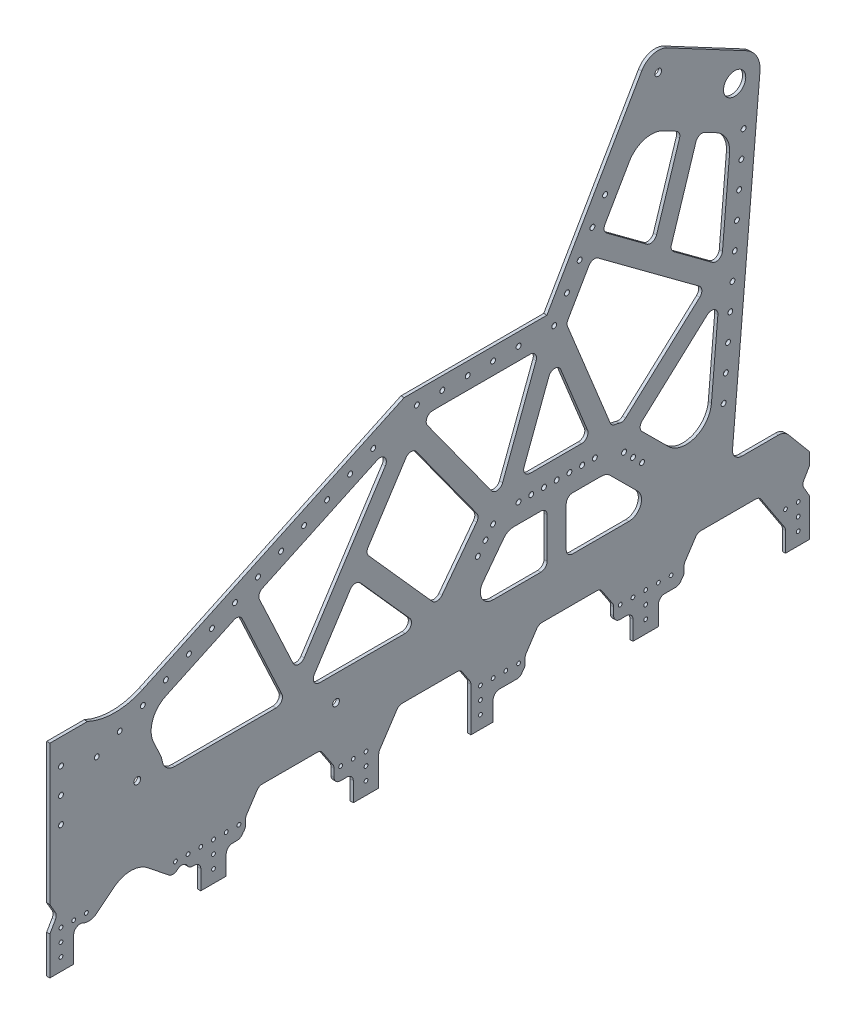
from build123d import *

# Parameters (mm, degrees)
BOSS_EXTRUDE1_DEPTH          = 3.175
F_1_4_CLEARANCE_HOLE1_D      = 6.7564
CUT_EXTRUDE4_START           = -3.175
CUT_EXTRUDE4_DEPTH           = 3.175
F_7_8_0_875_DIAMETER_HOLE1_D = 22.225
F_6_CLEARANCE_HOLE1_D        = 3.7973
F_8_CLEARANCE_HOLE1_D        = 4.9149
F_8_CLEARANCE_HOLE2_D        = 4.9149
CUT_EXTRUDE8_DEPTH           = 607.618253258


# Read off the part's stored shape, not the designer's step: Cut-Extrude4
with BuildPart() as part:
    # Sketch1 → Boss-Extrude1 (new body)
    with BuildSketch(Plane(origin=(0, 0, 0), x_dir=(0, 0, -1), z_dir=(1, 0, 0))):
        with BuildLine():
            Line((-379.4125, -25.4), (379.4125, -25.4))
            Line((379.4125, -25.4), (379.4125, 12.7))
            Line((379.4125, 12.7), (373.913238686, 22.225))
            ThreePointArc((373.913238686, 22.225), (373.0625, 25.4), (373.913238686, 28.575))
            Line((373.913238686, 28.575), (379.4125, 38.1))
            Line((379.4125, 38.1), (379.4125, 50.8))
            Line((379.4125, 50.8), (358.334081892, 75.920280507))
            ThreePointArc((358.334081892, 75.920280507), (353.972569388, 79.266986759), (348.605317464, 80.456877864))
            Line((348.605317464, 80.456877864), (312.169853675, 80.456877864))
            ThreePointArc((312.169853675, 80.456877864), (305.147287042, 83.546881136), (302.681099176, 90.812036313))
            Line((302.681099176, 90.812036313), (330.103345332, 404.249744134))
            ThreePointArc((330.103345332, 404.249744134), (327.121530688, 418.584113341), (316.72300865, 428.891203064))
            Line((316.72300865, 428.891203064), (237.363712035, 471.080168083))
            ThreePointArc((237.363712035, 471.080168083), (223.169923354, 472.571242401), (211.923671605, 463.784390785))
            Line((211.923671605, 463.784390785), (117.237713163, 299.7835))
            Line((117.237713163, 299.7835), (-25.4, 299.7835))
            Line((-25.4, 299.7835), (-286.994459938, 177.8))
            ThreePointArc((-286.994459938, 177.8), (-314.449155618, 171.713440503), (-341.903851297, 177.8))
            Line((-341.903851297, 177.8), (-379.4125, 177.8))
            Line((-379.4125, 177.8), (-379.4125, 38.1))
            Line((-379.4125, 38.1), (-373.913238686, 28.575))
            ThreePointArc((-373.913238686, 28.575), (-373.0625, 25.4), (-373.913238686, 22.225))
            Line((-373.913238686, 22.225), (-379.4125, 12.7))
            Line((-379.4125, 12.7), (-379.4125, -25.4))
        make_face()
    extrude(amount=BOSS_EXTRUDE1_DEPTH)

    # 1/4 Clearance Hole1 (through all)
    with Locations(Plane(origin=(0, 0, 0), x_dir=(0, 0, -1), z_dir=(-1, 0, 0))):
        with Locations((-292.1, -101.6635), (-93.476017085, -69.9135), (228.421455547, -454.259390785)):
            Hole(F_1_4_CLEARANCE_HOLE1_D / 2)

    # Cut-Extrude4 outline → Cut-Extrude4 (cut)
    with BuildSketch(Plane(origin=(3.175, 0, 0), x_dir=(0, 0, -1), z_dir=(1, 0, 0)).offset(CUT_EXTRUDE4_START)):
        with BuildLine():
            Line((228.6, -6.35), (228.6, -25.4))
            Line((228.6, -25.4), (355.6, -25.4))
            Line((355.6, -25.4), (355.6, -5.68485798))
            ThreePointArc((355.6, -5.68485798), (355.335085484, -3.869855319), (354.562445777, -2.206292203))
            Line((354.562445777, -2.206292203), (331.164598945, 33.526765777))
            ThreePointArc((331.164598945, 33.526765777), (328.871557688, 35.634405899), (325.852153167, 36.3982))
            Line((325.852153167, 36.3982), (271.047846833, 36.3982))
            ThreePointArc((271.047846833, 36.3982), (268.028442312, 35.634405899), (265.735401055, 33.526765777))
            Line((265.735401055, 33.526765777), (255.263259125, 17.533770462))
            ThreePointArc((255.263259125, 17.533770462), (254.490619419, 15.870207345), (254.225704902, 14.055204685))
            Line((254.225704902, 14.055204685), (254.225704902, 9.041792552))
            ThreePointArc((254.225704902, 9.041792552), (253.733950669, 6.591597349), (252.334852451, 4.520896276))
            ThreePointArc((252.334852451, 4.520896276), (251.7695263, 3.882932401), (251.294738686, 3.175))
            ThreePointArc((251.294738686, 3.175), (248.970477372, 0.850738686), (245.795477372, 0))
            Line((245.795477372, 0), (234.95, 0))
            ThreePointArc((234.95, 0), (230.459871939, -1.859871939), (228.6, -6.35))
        make_face()
        with BuildLine():
            Line((63.5, -6.35), (63.5, -25.4))
            Line((63.5, -25.4), (203.2, -25.4))
            Line((203.2, -25.4), (203.2, -6.35))
            ThreePointArc((203.2, -6.35), (201.340128061, -1.859871939), (196.85, 0))
            Line((196.85, 0), (190.274295098, 0))
            ThreePointArc((190.274295098, 0), (185.784167037, 1.859871939), (183.924295098, 6.35))
            Line((183.924295098, 6.35), (183.924295098, 14.06007184))
            ThreePointArc((183.924295098, 14.06007184), (183.65487103, 15.890125483), (182.869461606, 17.564884481))
            Line((182.869461606, 17.564884481), (172.287094914, 33.553012641))
            ThreePointArc((172.287094914, 33.553012641), (169.99750154, 35.641859816), (166.991928406, 36.3982))
            Line((166.991928406, 36.3982), (112.297846833, 36.3982))
            ThreePointArc((112.297846833, 36.3982), (109.278442312, 35.634405899), (106.985401055, 33.526765777))
            Line((106.985401055, 33.526765777), (96.513259125, 17.533770462))
            ThreePointArc((96.513259125, 17.533770462), (95.740619418, 15.870207346), (95.475704902, 14.055204685))
            Line((95.475704902, 14.055204685), (95.475704902, 9.041792552))
            ThreePointArc((95.475704902, 9.041792552), (94.983950669, 6.591597349), (93.584852451, 4.520896276))
            ThreePointArc((93.584852451, 4.520896276), (93.0195263, 3.882932401), (92.544738686, 3.175))
            ThreePointArc((92.544738686, 3.175), (90.220477372, 0.850738686), (87.045477372, 0))
            Line((87.045477372, 0), (69.85, 0))
            ThreePointArc((69.85, 0), (65.359871939, -1.859871939), (63.5, -6.35))
        make_face()
        with BuildLine():
            Line((-50.8, 3.885825734), (-50.8, -25.4))
            Line((-50.8, -25.4), (41.275, -25.4))
            Line((41.275, -25.4), (41.275, 18.388947296))
            ThreePointArc((41.275, 18.388947296), (41.005575932, 20.219000939), (40.220166508, 21.893759937))
            Line((40.220166508, 21.893759937), (32.587094914, 33.426012641))
            ThreePointArc((32.587094914, 33.426012641), (30.29750154, 35.514859816), (27.291928406, 36.2712))
            Line((27.291928406, 36.2712), (-27.402153167, 36.2712))
            ThreePointArc((-27.402153167, 36.2712), (-30.421557688, 35.507405899), (-32.714598945, 33.399765777))
            Line((-32.714598945, 33.399765777), (-49.762445777, 7.364391511))
            ThreePointArc((-49.762445777, 7.364391511), (-50.535085484, 5.700828395), (-50.8, 3.885825734))
        make_face()
        with BuildLine():
            Line((-355.6, -25.4), (-228.6, -25.4))
            Line((-228.6, -25.4), (-228.6, -6.35))
            ThreePointArc((-228.6, -6.35), (-230.459871939, -1.859871939), (-234.95, 0))
            Line((-234.95, 0), (-236.651477372, 0))
            ThreePointArc((-236.651477372, 0), (-239.826477372, 0.850738686), (-242.150738686, 3.175))
            ThreePointArc((-242.150738686, 3.175), (-246.773772418, 6.289254743), (-252.071994637, 4.557242964))
            ThreePointArc((-252.071994637, 4.557242964), (-256.191826183, 2.771679177), (-260.462739274, 4.157518766))
            Line((-260.462739274, 4.157518766), (-281.5828125, 21.067110435))
            ThreePointArc((-281.5828125, 21.067110435), (-298.45, 26.9875), (-315.3171875, 21.067110435))
            Line((-315.3171875, 21.067110435), (-332.754905569, 7.10576243))
            ThreePointArc((-332.754905569, 7.10576243), (-339.366140336, 4.389137758), (-346.397468523, 5.673232251))
            ThreePointArc((-346.397468523, 5.673232251), (-352.582335902, 5.405371166), (-355.6, 0))
            Line((-355.6, 0), (-355.6, -25.4))
        make_face()
        with BuildLine():
            Line((-76.2, -25.4), (-76.2, -6.35))
            ThreePointArc((-76.2, -6.35), (-78.059871939, -1.859871939), (-82.55, 0))
            Line((-82.55, 0), (-89.125704902, 0))
            ThreePointArc((-89.125704902, 0), (-93.615832963, 1.859871939), (-95.475704902, 6.35))
            Line((-95.475704902, 6.35), (-95.475704902, 14.106934369))
            ThreePointArc((-95.475704902, 14.106934369), (-95.74512897, 15.936988012), (-96.530538394, 17.61174701))
            Line((-96.530538394, 17.61174701), (-107.023045357, 33.464112641))
            ThreePointArc((-107.023045357, 33.464112641), (-109.312638731, 35.552959816), (-112.318211865, 36.3093))
            Line((-112.318211865, 36.3093), (-167.160364491, 36.3093))
            ThreePointArc((-167.160364491, 36.3093), (-170.179769011, 35.545505899), (-172.472810268, 33.437865777))
            Line((-172.472810268, 33.437865777), (-182.886740875, 17.533770462))
            ThreePointArc((-182.886740875, 17.533770462), (-183.659380581, 15.870207345), (-183.924295098, 14.055204685))
            Line((-183.924295098, 14.055204685), (-183.924295098, 9.041792552))
            ThreePointArc((-183.924295098, 9.041792552), (-184.416049331, 6.591597349), (-185.815147549, 4.520896276))
            ThreePointArc((-185.815147549, 4.520896276), (-186.3804737, 3.882932401), (-186.855261314, 3.175))
            ThreePointArc((-186.855261314, 3.175), (-189.179522628, 0.850738686), (-192.354522628, 0))
            Line((-192.354522628, 0), (-196.85, 0))
            ThreePointArc((-196.85, 0), (-201.340128061, -1.859871939), (-203.2, -6.35))
            Line((-203.2, -6.35), (-203.2, -25.4))
            Line((-203.2, -25.4), (-76.2, -25.4))
        make_face()
    extrude(amount=CUT_EXTRUDE4_DEPTH, mode=Mode.SUBTRACT)

    # 7/8 (0.875) Diameter Hole1 (through all)
    with Locations(Plane(origin=(3.175, 0, 0), x_dir=(0, 0, -1), z_dir=(1, 0, 0))):
        with Locations((304.8, 406.4635)):
            Hole(F_7_8_0_875_DIAMETER_HOLE1_D / 2)

    # #6 Clearance Hole1 (through all)
    with Locations(Plane(origin=(0, -76.1365, 0), x_dir=(0, 0, 1), z_dir=(-1, 0, 0))):
        with Locations((-368.3, 63.4365), (-368.3, 76.1365), (-368.3, 88.8365), (-355.6, 88.8365), (-241.3, 88.8365), (-228.6, 88.8365), (-215.9, 63.4365), (-215.9, 76.1365), (-215.9, 88.8365), (-203.2, 88.8365), (-190.5, 88.8365), (-88.9, 88.8365), (-76.2, 88.8365), (-63.5, 88.8365), (-50.8, 63.4365), (-50.8, 76.1365), (-50.8, 88.8365), (63.5, 63.4365), (63.5, 76.1365), (63.5, 88.8365), (76.2, 88.8365), (88.9, 88.8365), (190.5, 88.8365), (203.2, 88.8365), (215.9, 63.4365), (215.9, 76.1365), (215.9, 88.8365), (228.6, 88.8365), (241.3, 88.8365), (254, 88.8365), (368.3, 63.4365), (342.9, 88.8365), (368.3, 76.1365), (355.6, 88.8365), (368.3, 88.8365)):
            Hole(F_6_CLEARANCE_HOLE1_D / 2)

    # #8 Clearance Hole1 (through all)
    with Locations(Plane(origin=(3.175, 0, 0), x_dir=(0, 0, -1), z_dir=(1, 0, 0))):
        with Locations((-368.3, 152.4635), (-368.3, 127.0635), (-368.3, 101.6635), (-332.579782209, 142.530315555), (-309.559564419, 153.264819403), (-286.539346628, 163.999323251), (-263.519128837, 174.733827099), (-240.498911046, 185.468330947), (-217.478693256, 196.202834796), (-194.458475465, 206.937338644), (-171.438257674, 217.671842492), (-148.418039883, 228.40634634), (-125.397822093, 239.140850189), (-102.377604302, 249.875354037), (-79.357386511, 260.609857885), (-56.33716872, 271.344361733), (-12.7, 287.0835), (12.7, 287.0835), (38.1, 287.0835), (63.5, 287.0835), (88.9, 287.0835), (124.570061582, 287.0835), (137.270061582, 309.080545256), (149.970061582, 331.077590512), (162.670061582, 353.074635768), (175.370061582, 375.071681025), (313.737453692, 362.902904929), (311.523697826, 337.599559597), (309.30994196, 312.296214266), (307.096186094, 286.992868934), (304.882430228, 261.689523603), (302.668674363, 236.386178271), (300.454918497, 211.08283294), (298.241162631, 185.779487608), (296.027406765, 160.476142277), (293.8136509, 135.172796945)):
            Hole(F_8_CLEARANCE_HOLE1_D / 2)

    # #8 Clearance Hole2 (through all)
    with Locations(Plane.ZY):
        with Locations((-165.1, 152.3365), (-152.4, 152.3365), (-114.3, 152.3365), (-139.7, 152.3365), (-88.9, 152.3365), (-101.6, 152.3365), (-127, 152.3365), (-194.274710368, 142.696831256), (-203.277445122, 133.739110175), (-212.280179876, 124.781389095), (-63.482153513, 145.96297655), (-55.837713392, 135.821352655), (-48.19327327, 125.67972876)):
            Hole(F_8_CLEARANCE_HOLE2_D / 2)

    # Sketch30 → Cut-Extrude8 (cut, through all)
    with BuildSketch(Plane.ZY):
        with BuildLine():
            Line((136.376192619, 125.363992488), (169.943574542, 197.349475327))
            ThreePointArc((169.943574542, 197.349475327), (170.155568236, 202.204929199), (166.872146056, 205.788155737))
            Line((166.872146056, 205.788155737), (52.246544849, 259.2389514))
            ThreePointArc((52.246544849, 259.2389514), (44.775207263, 257.655265721), (44.229585372, 250.037441727))
            Line((44.229585372, 250.037441727), (125.287804656, 124.601163225))
            ThreePointArc((125.287804656, 124.601163225), (131.056958383, 121.712591952), (136.376192619, 125.363992488))
        make_face()
        with BuildLine():
            Line((-61.863611336, 175.531784016), (2.16801914, 264.194540557))
            ThreePointArc((2.16801914, 264.194540557), (2.737276652, 270.675781259), (-2.695317687, 274.255928449))
            ThreePointArc((-2.695317687, 274.255928449), (-5.540077297, 274.351603107), (-8.386266587, 274.3835))
            Line((-8.386266587, 274.3835), (-100.435678796, 274.3835))
            ThreePointArc((-100.435678796, 274.3835), (-105.657229416, 271.647072903), (-106.378498901, 265.796227284))
            Line((-106.378498901, 265.796227284), (-72.954315712, 177.01227777))
            ThreePointArc((-72.954315712, 177.01227777), (-67.851701644, 172.955382247), (-61.863611336, 175.531784016))
        make_face()
        with BuildLine():
            Line((-137.834627872, 279.753602675), (-180.428032241, 175.045202524))
            ThreePointArc((-180.428032241, 175.045202524), (-182.412405001, 172.424773921), (-185.441136524, 171.147602563))
            ThreePointArc((-185.441136524, 171.147602563), (-187.580897512, 170.758038886), (-189.679487393, 170.186849372))
            ThreePointArc((-189.679487393, 170.186849372), (-192.962895199, 170.033179303), (-195.883244804, 171.541801023))
            Line((-195.883244804, 171.541801023), (-269.977342405, 239.010476976))
            ThreePointArc((-269.977342405, 239.010476976), (-272.043892501, 244.027204694), (-269.480456819, 248.80914821))
            Line((-269.480456819, 248.80914821), (-168.47523717, 323.588622462))
            ThreePointArc((-168.47523717, 323.588622462), (-163.404482625, 324.702189158), (-159.197560186, 321.660086921))
            Line((-159.197560186, 321.660086921), (-138.217339279, 285.321278355))
            ThreePointArc((-138.217339279, 285.321278355), (-137.381549278, 282.5817377), (-137.834627872, 279.753602675))
        make_face()
        with BuildLine():
            Line((-266.136725798, 375.387944217), (-241.633196285, 298.477766208))
            ThreePointArc((-241.633196285, 298.477766208), (-241.641153046, 294.597694288), (-243.905129056, 291.446593838))
            Line((-243.905129056, 291.446593838), (-282.529367625, 262.851039434))
            ThreePointArc((-282.529367625, 262.851039434), (-288.915115786, 262.164556213), (-292.633619628, 267.401136009))
            Line((-292.633619628, 267.401136009), (-299.72733772, 348.482704821))
            ThreePointArc((-299.72733772, 348.482704821), (-296.745523076, 362.817074027), (-286.347001038, 373.12416375))
            Line((-286.347001038, 373.12416375), (-275.167826402, 379.067233155))
            ThreePointArc((-275.167826402, 379.067233155), (-269.791266004, 379.341004873), (-266.136725798, 375.387944217))
        make_face()
        with BuildLine():
            Line((19.692843228, 105.889297983), (69.226575751, 161.447323755))
            ThreePointArc((69.226575751, 161.447323755), (74.456144109, 163.552605284), (79.299648858, 160.667980998))
            Line((79.299648858, 160.667980998), (115.201819186, 105.109955226))
            ThreePointArc((115.201819186, 105.109955226), (115.445558859, 98.627259782), (109.868485671, 95.3135))
            Line((109.868485671, 95.3135), (24.432582821, 95.3135))
            ThreePointArc((24.432582821, 95.3135), (18.637916429, 99.066513014), (19.692843228, 105.889297983))
        make_face()
        with BuildLine():
            Line((147.595216163, 104.347125962), (187.208737885, 189.298597441))
            ThreePointArc((187.208737885, 189.298597441), (190.791964423, 192.582019621), (195.647418295, 192.370025926))
            Line((195.647418295, 192.370025926), (263.575150857, 160.694804031))
            ThreePointArc((263.575150857, 160.694804031), (276.708839577, 146.361897881), (275.8608648, 126.940082392))
            Line((275.8608648, 126.940082392), (269.079782209, 112.398003848))
            ThreePointArc((269.079782209, 112.398003848), (267.848684731, 109.215566455), (267.055262252, 105.896833333))
            ThreePointArc((267.055262252, 105.896833333), (262.730708127, 98.313714779), (254.532893377, 95.3135))
            Line((254.532893377, 95.3135), (153.350270611, 95.3135))
            ThreePointArc((153.350270611, 95.3135), (147.99473493, 98.251647487), (147.595216163, 104.347125962))
        make_face()
        with BuildLine():
            Line((23.706927731, 246.696814491), (61.424763587, 188.329075788))
            ThreePointArc((61.424763587, 188.329075788), (62.422509584, 184.392791797), (60.831169665, 180.656822579))
            Line((60.831169665, 180.656822579), (-2.623794089, 109.484465236))
            ThreePointArc((-2.623794089, 109.484465236), (-7.624533703, 107.365629345), (-12.43434563, 109.888043158))
            Line((-12.43434563, 109.888043158), (-47.067666547, 155.834915575))
            ThreePointArc((-47.067666547, 155.834915575), (-48.346522885, 159.592230521), (-47.144738871, 163.374902106))
            Line((-47.144738871, 163.374902106), (13.225709945, 246.968125735))
            ThreePointArc((13.225709945, 246.968125735), (18.537911907, 249.598232901), (23.706927731, 246.696814491))
        make_face()
        with BuildLine():
            Line((-119.199420671, 245.782990618), (-94.424454399, 179.973772716))
            ThreePointArc((-94.424454399, 179.973772716), (-95.145723884, 174.122927097), (-100.367274504, 171.3865))
            Line((-100.367274504, 171.3865), (-151.912190706, 171.3865))
            ThreePointArc((-151.912190706, 171.3865), (-157.180776406, 174.191855488), (-157.794163426, 180.12917568))
            Line((-157.794163426, 180.12917568), (-131.024213496, 245.938393583))
            ThreePointArc((-131.024213496, 245.938393583), (-125.058795456, 249.895169601), (-119.199420671, 245.782990618))
        make_face()
        with BuildLine():
            Line((-212.461661205, 160.873360573), (-277.428972752, 220.031358744))
            ThreePointArc((-277.428972752, 220.031358744), (-284.521729866, 221.026956088), (-288.030110341, 214.782784085))
            Line((-288.030110341, 214.782784085), (-281.615274747, 141.460877738))
            ThreePointArc((-281.615274747, 141.460877738), (-265.029144181, 119.817346106), (-238.396487256, 125.669164096))
            Line((-238.396487256, 125.669164096), (-212.258101921, 151.676857504))
            ThreePointArc((-212.258101921, 151.676857504), (-210.388517426, 156.318744045), (-212.461661205, 160.873360573))
        make_face()
        with BuildLine():
            Line((-249.741432093, 386.68170037), (-226.771264292, 314.584344214))
            ThreePointArc((-226.771264292, 314.584344214), (-222.673350944, 310.469589362), (-216.942500182, 311.4084455))
            Line((-216.942500182, 311.4084455), (-176.896573808, 341.056550128))
            ThreePointArc((-176.896573808, 341.056550128), (-174.45788724, 344.867746796), (-175.175728164, 349.33508567))
            Line((-175.175728164, 349.33508567), (-199.529822274, 391.517614041))
            ThreePointArc((-199.529822274, 391.517614041), (-214.524824606, 403.233416196), (-233.44987618, 401.245317105))
            Line((-233.44987618, 401.245317105), (-246.671835814, 394.216262964))
            ThreePointArc((-246.671835814, 394.216262964), (-249.571781136, 391.005145433), (-249.741432093, 386.68170037))
        make_face()
        with BuildLine():
            Line((-180.439630628, 129.589234754), (-208.007090061, 102.159612618))
            ThreePointArc((-208.007090061, 102.159612618), (-210.788720142, 88.3115054), (-199.049368981, 80.456877864))
            Line((-199.049368981, 80.456877864), (-142.875, 80.456877864))
            ThreePointArc((-142.875, 80.456877864), (-138.384871939, 82.316749803), (-136.525, 86.806877864))
            Line((-136.525, 86.806877864), (-136.525, 126.9365))
            ThreePointArc((-136.525, 126.9365), (-138.384871939, 131.426628061), (-142.875, 133.2865))
            Line((-142.875, 133.2865), (-171.481909548, 133.2865))
            ThreePointArc((-171.481909548, 133.2865), (-176.327282011, 132.325851161), (-180.439630628, 129.589234754))
        make_face()
        with BuildLine():
            Line((-84.113567839, 133.2865), (-111.125, 133.2865))
            ThreePointArc((-111.125, 133.2865), (-115.615128061, 131.426628061), (-117.475, 126.9365))
            Line((-117.475, 126.9365), (-117.475, 86.806877864))
            ThreePointArc((-117.475, 86.806877864), (-115.615128061, 82.316749803), (-111.125, 80.456877864))
            Line((-111.125, 80.456877864), (-63.437973264, 80.456877864))
            ThreePointArc((-63.437973264, 80.456877864), (-52.07191877, 87.490944117), (-53.296349369, 100.801317985))
            Line((-53.296349369, 100.801317985), (-73.971943944, 128.230940122))
            ThreePointArc((-73.971943944, 128.230940122), (-78.447634092, 131.952554495), (-84.113567839, 133.2865))
        make_face()
    extrude(amount=-CUT_EXTRUDE8_DEPTH, mode=Mode.SUBTRACT)


solid = part.part
